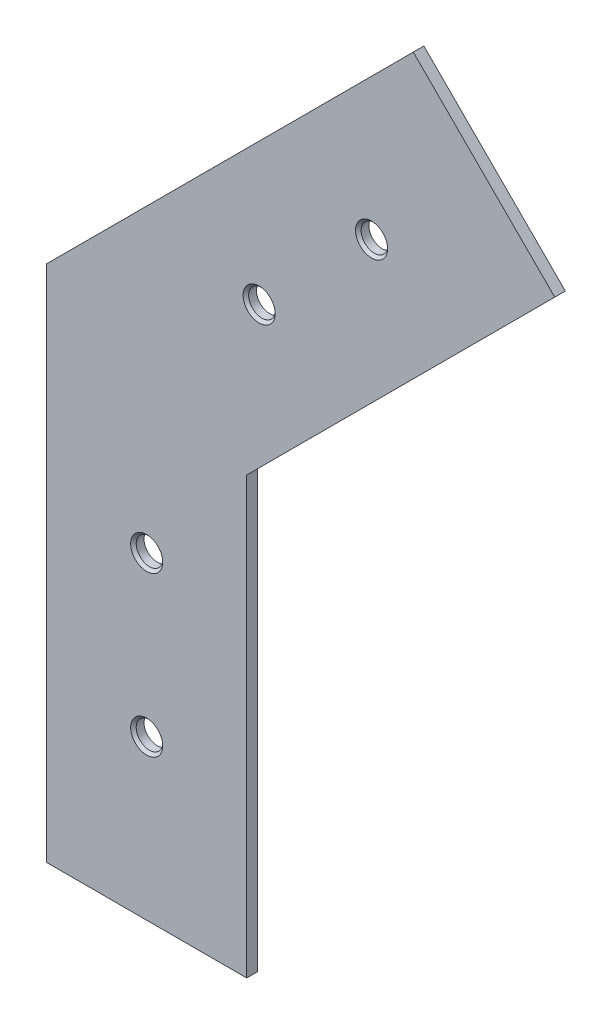
from build123d import *

# Parameters (mm, degrees)
BASE_FLANGE2_DEPTH              = 2
M6X1_0_TAPPED_HOLE1_D           = 5
M6X1_0_TAPPED_HOLE1_DEPTH       = 15
M6X1_0_TAPPED_HOLE1_CSINK_D     = 6.05
M6X1_0_TAPPED_HOLE1_CSINK_ANGLE = 90
M6X1_0_TAPPED_HOLE1_TIP         = 1.502151548


# Sheet-metal steps are written as plain solids
with BuildPart() as part:
    # Sketch1 → Base-Flange2 (new body)
    with BuildSketch(Plane.XY):
        Polygon((18.875, 0), (18.875, 82.18171901), (76.986250802, 140.292969812), (50.292969812, 166.986250802), (-18.875, 97.81828099), (-18.875, 0), align=None)
    extrude(amount=-BASE_FLANGE2_DEPTH)

    # M6x1.0 Tapped Hole1
    with Locations(Plane.XY):
        with Locations((42.426406871, 132.426406871), (21.213203436, 111.213203436), (0, 60), (0, 30)):
            CounterSinkHole(M6X1_0_TAPPED_HOLE1_D / 2, M6X1_0_TAPPED_HOLE1_CSINK_D / 2, depth=M6X1_0_TAPPED_HOLE1_DEPTH, counter_sink_angle=M6X1_0_TAPPED_HOLE1_CSINK_ANGLE)
            with Locations((0, 0, -(M6X1_0_TAPPED_HOLE1_DEPTH + M6X1_0_TAPPED_HOLE1_TIP / 2))):  # 118° drill point
                Cone(0, M6X1_0_TAPPED_HOLE1_D / 2, M6X1_0_TAPPED_HOLE1_TIP, mode=Mode.SUBTRACT)


solid = part.part
